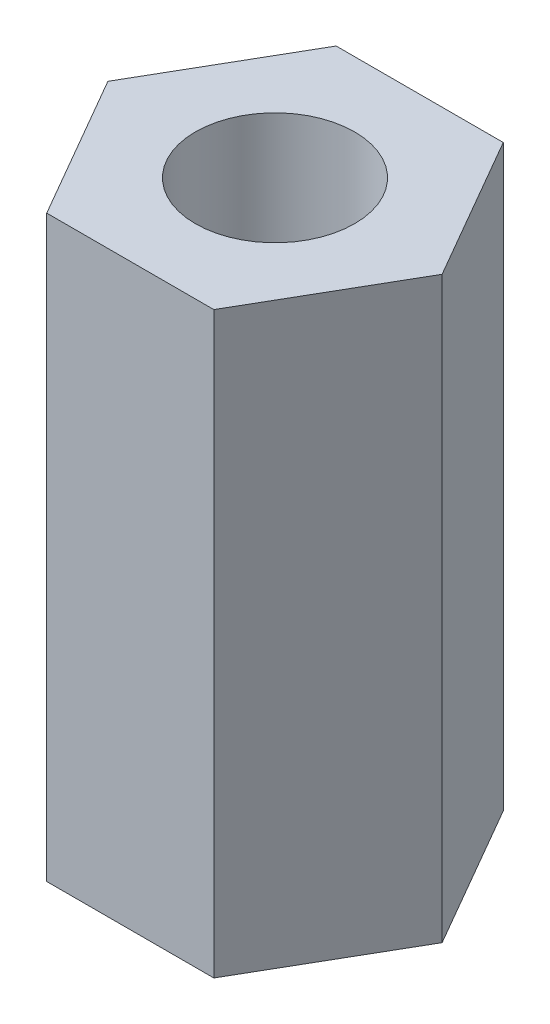
from build123d import *

# Parameters (mm, degrees)
SKETCH1_R           = 1.375
BOSS_EXTRUDE1_DEPTH = 5


with BuildPart() as part:
    # Sketch1 → Boss-Extrude1 (new, symmetric)
    with BuildSketch(Plane(origin=(0, 0, 0), x_dir=(1, 0, 0), z_dir=(0, 1, 0))):
        Polygon((2.886751346, 0), (1.443375673, 2.5), (-1.443375673, 2.5), (-2.886751346, 0), (-1.443375673, -2.5), (1.443375673, -2.5), align=None)
        Circle(SKETCH1_R, mode=Mode.SUBTRACT)
    extrude(amount=BOSS_EXTRUDE1_DEPTH, both=True)


solid = part.part
